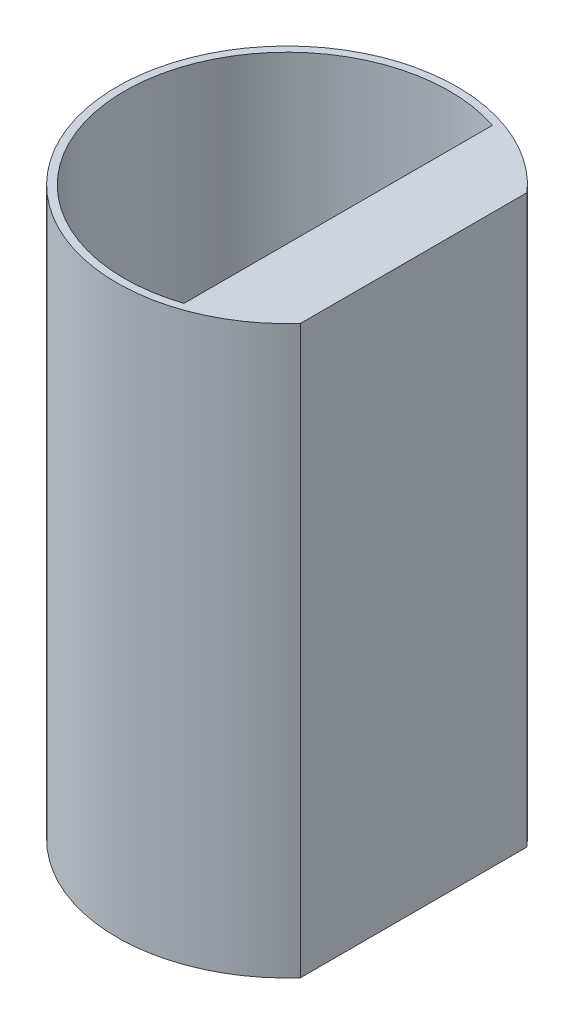
from build123d import *

# Parameters (mm, degrees)
SKETCH1_R           = 57.15
BOSS_EXTRUDE1_DEPTH = 190.5
CUT_EXTRUDE1_START  = -190.5
CUT_EXTRUDE1_DEPTH  = 190.5
SHELL2_START        = 12.7
SHELL2_DEPTH        = 177.8


# Read off the part's stored shape, not the designer's step: Shell2
with BuildPart() as part:
    # Sketch1 → Boss-Extrude1 (new body)
    with BuildSketch(Plane(origin=(0, 0, 0), x_dir=(1, 0, 0), z_dir=(0, 1, 0))):
        with Locations(Location((0, 0, 0), (0, 0, 270))):
            Circle(SKETCH1_R)
    extrude(amount=BOSS_EXTRUDE1_DEPTH)

    # Sketch2 → Cut-Extrude1 (cut)
    with BuildSketch(Plane(origin=(0, 190.5, 0), x_dir=(1, 0, 0), z_dir=(0, 1, 0)).offset(CUT_EXTRUDE1_START)):
        with BuildLine():
            Line((42.597094971, 38.1), (42.597094971, -38.1))
            ThreePointArc((42.597094971, -38.1), (53.387950315, -20.392382431), (57.15, 0))
            ThreePointArc((57.15, 0), (53.387950315, 20.392382431), (42.597094971, 38.1))
        make_face()
    extrude(amount=CUT_EXTRUDE1_DEPTH, mode=Mode.SUBTRACT)

    # Shell2 outline → Shell2 (cut)
    with BuildSketch(Plane(origin=(0, 0, 0), x_dir=(1, 0, 0), z_dir=(0, 1, 0)).offset(SHELL2_START)):
        with BuildLine():
            ThreePointArc((17.197094971, 51.831573626), (-54.61, 0), (17.197094971, -51.831573626))
            Line((17.197094971, -51.831573626), (17.197094971, 51.831573626))
        make_face()
    extrude(amount=SHELL2_DEPTH, mode=Mode.SUBTRACT)


solid = part.part
